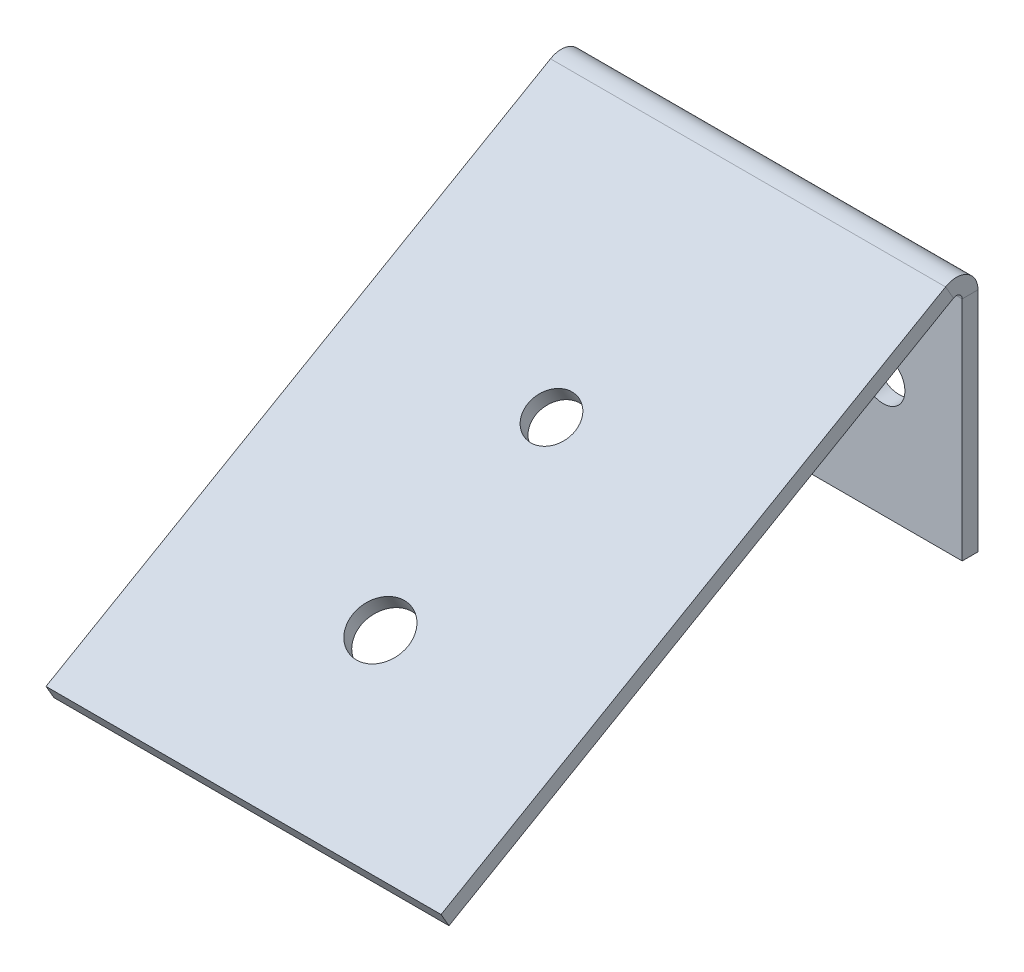
from build123d import *

# Parameters (mm, degrees)
FLANGE_BASE1_DEPTH          = 50
CORTE_EXTRUS_O2_REACH       = 80.784
ESBO_O2_R                   = 3
ESBO_O2_R_2                 = 3.5
FURO_COM_FOLGA_DE_M51_D     = 5.5
FURO_COM_FOLGA_DE_M51_DEPTH = 2


# Sheet-metal steps are written as plain solids
with BuildPart() as part:
    # Esboço1 → Flange-base1 (new body)
    with BuildSketch(Plane(origin=(0, 0, 0), x_dir=(0, 0, -1), z_dir=(1, 0, 0))):
        with BuildLine():
            Line((0, 0), (0, 28.724171375))
            ThreePointArc((0, 28.724171375), (-0.3683, 29.362085688), (-1.1049, 29.362085688))
            Line((-1.1049, 29.362085688), (-64.951905284, -7.5))
            Line((-64.951905284, -7.5), (-65.951905284, -5.767949192))
            Line((-65.951905284, -5.767949192), (-2.1049, 31.094136495))
            ThreePointArc((-2.1049, 31.094136495), (0.6317, 31.094136495), (2, 28.724171375))
            Line((2, 28.724171375), (2, 0))
            Line((2, 0), (0, 0))
        make_face()
    extrude(amount=FLANGE_BASE1_DEPTH)

    # Esboço2 → Corte-extrusão2 (cut, up to next)
    with BuildSketch(Plane(origin=(0, 24.232050808, 13.990381057), x_dir=(1, 0, 0), z_dir=(0, 0.866025403784436, 0.5000000000000044)), mode=Mode.PRIVATE) as corte_extrus_o2_sk1:
        with Locations(Location((25, -15, 0), (0, 0, 270))):
            Circle(ESBO_O2_R)
    corte_extrus_o2_tool1 = extrude(corte_extrus_o2_sk1.sketch, amount=-CORTE_EXTRUS_O2_REACH, mode=Mode.PRIVATE) & part.part
    # Esboço2 → Corte-extrusão2 (cut, up to next)
    with BuildSketch(Plane(origin=(0, 24.232050808, 13.990381057), x_dir=(1, 0, 0), z_dir=(0, 0.866025403784436, 0.5000000000000044)), mode=Mode.PRIVATE) as corte_extrus_o2_sk2:
        with Locations(Location((25, -40, 0), (0, 0, 270))):
            Circle(ESBO_O2_R_2)
    corte_extrus_o2_tool2 = extrude(corte_extrus_o2_sk2.sketch, amount=-CORTE_EXTRUS_O2_REACH, mode=Mode.PRIVATE) & part.part
    add(corte_extrus_o2_tool1.solids().sort_by_distance((25, 16.732051, 26.980762))[0], mode=Mode.SUBTRACT)
    add(corte_extrus_o2_tool2.solids().sort_by_distance((25, 4.232051, 48.631397))[0], mode=Mode.SUBTRACT)

    # Furo com folga de M51
    with Locations(Plane(origin=(0, 0, -2), x_dir=(-1, 0, 0), z_dir=(0, 0, -1))):
        with Locations((-10, 15), (-40, 15)):
            Hole(FURO_COM_FOLGA_DE_M51_D / 2, depth=FURO_COM_FOLGA_DE_M51_DEPTH)


solid = part.part
